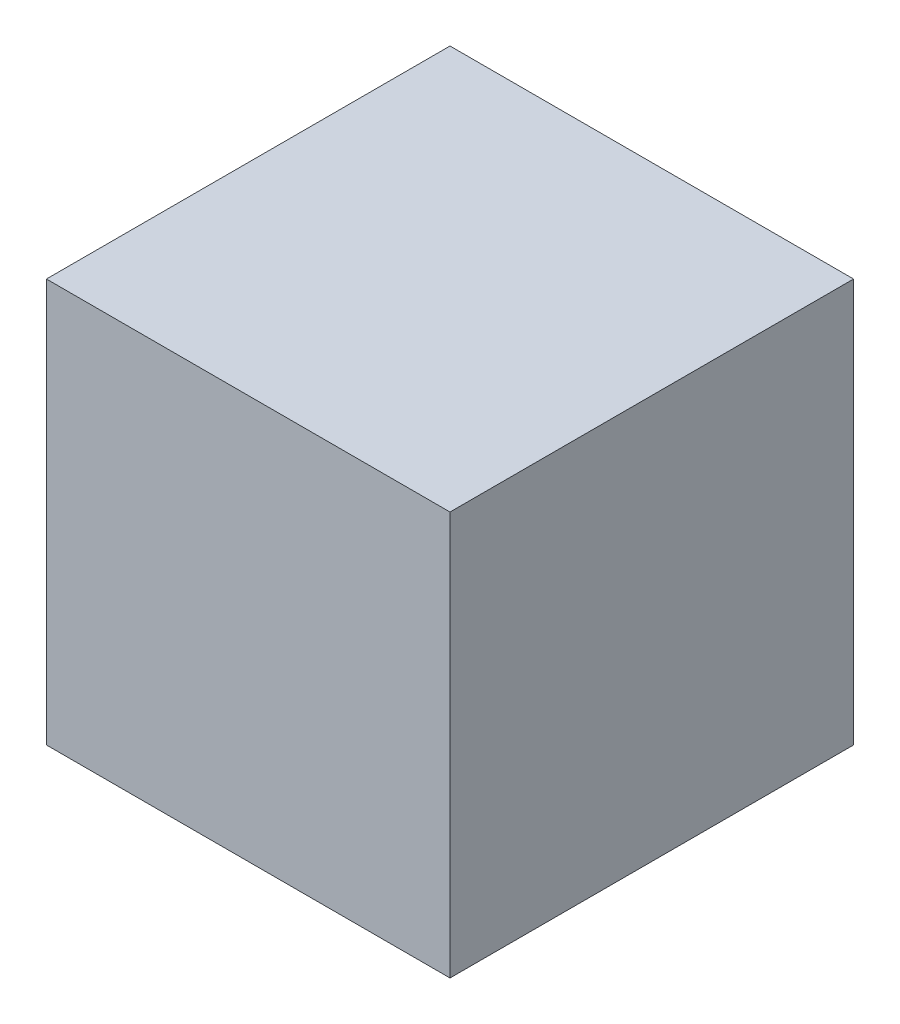
from build123d import *

# Parameters (mm, degrees)
SKETCH1_W           = 100
SKETCH1_H           = 100
BOSS_EXTRUDE1_DEPTH = 100
SKETCH2_R           = 4
CUT_EXTRUDE1_DEPTH  = 10


with BuildPart() as part:
    # Sketch1 → Boss-Extrude1 (new body)
    with BuildSketch(Plane(origin=(0, 0, 0), x_dir=(0, 0, -1), z_dir=(1, 0, 0))):
        Rectangle(SKETCH1_W, SKETCH1_H)
    extrude(amount=BOSS_EXTRUDE1_DEPTH)

    # Sketch2 → Cut-Extrude1 (cut)
    with BuildSketch(Plane.ZY):
        Circle(SKETCH2_R)
    extrude(amount=-CUT_EXTRUDE1_DEPTH, mode=Mode.SUBTRACT)


solid = part.part
